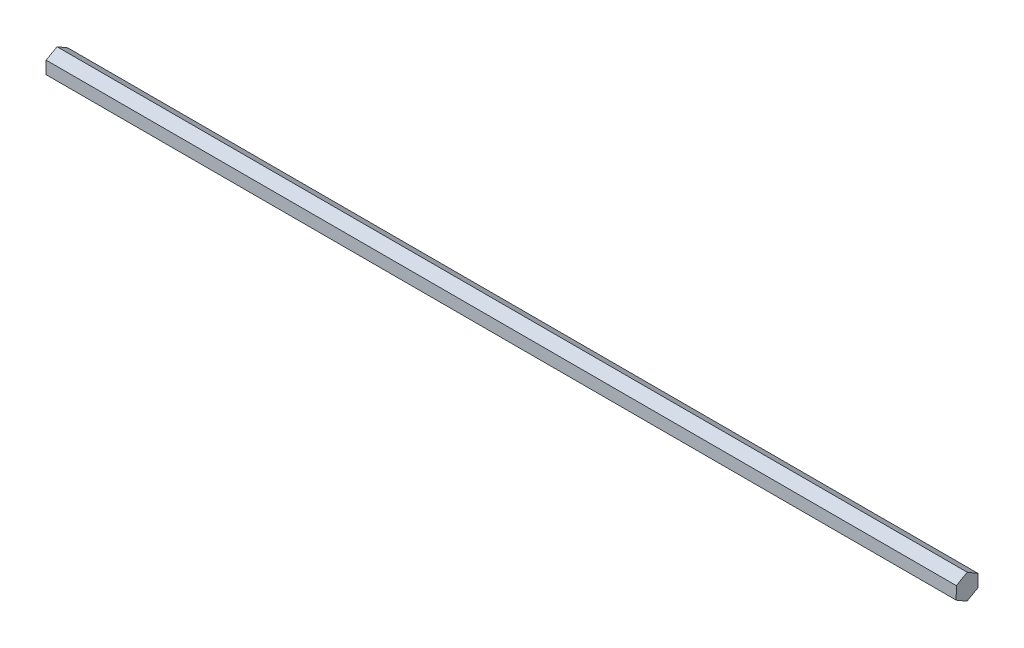
from build123d import *

# Parameters (mm, degrees)
BOSS_EXTRUDE1_DEPTH = 533.4


with BuildPart() as part:
    # Sketch1 → Boss-Extrude1 (new body)
    with BuildSketch(Plane(origin=(0, 0, 0), x_dir=(0, 0, -1), z_dir=(1, 0, 0))):
        Polygon((6.387063012, 3.601216379), (0.074786637, 7.331967014), (-6.312276375, 3.730750635), (-6.387063012, -3.601216379), (-0.074786637, -7.331967014), (6.312276375, -3.730750635), align=None)
    extrude(amount=BOSS_EXTRUDE1_DEPTH)


solid = part.part
